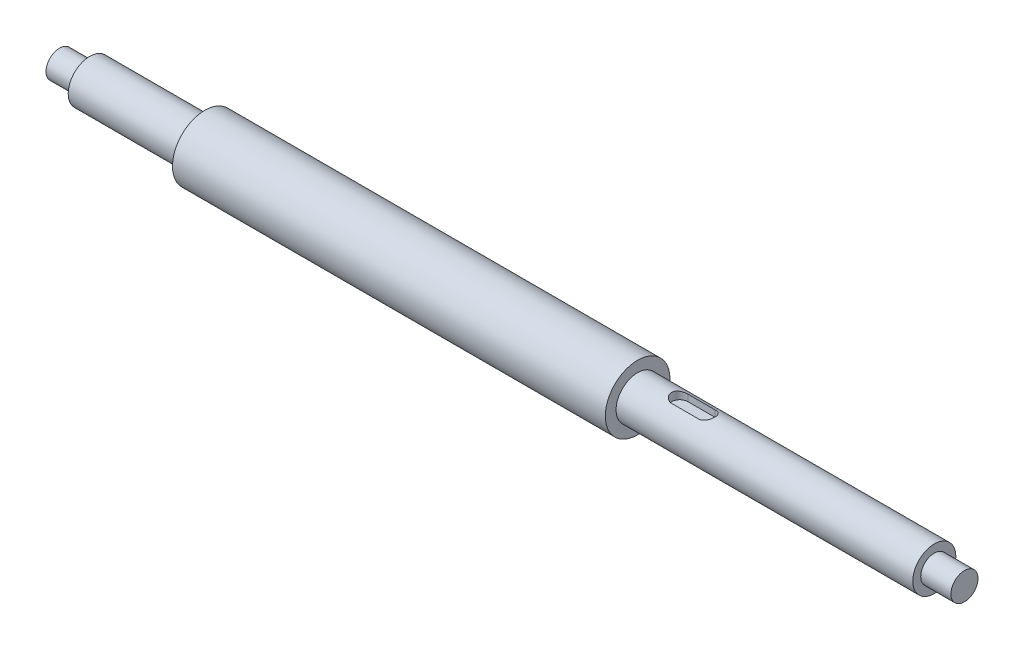
from build123d import *

# Parameters (mm, degrees)
SKETCH1_R           = 9.525
BOSS_EXTRUDE1_DEPTH = 266.7
SKETCH4_R           = 9.525
SKETCH4_R_2         = 6.35
CUT_EXTRUDE3_DEPTH  = 42.799
SKETCH5_R           = 6.35
SKETCH5_R_2         = 4
CUT_EXTRUDE4_DEPTH  = 8.89
CUT_EXTRUDE5_START  = -96.3295
SKETCH6_R           = 9.525
SKETCH6_R_2         = 6.35
CUT_EXTRUDE5_DEPTH  = 96.3295
CUT_EXTRUDE6_DEPTH  = 2.3876


with BuildPart() as part:
    # Sketch1 → Boss-Extrude1 (new body)
    with BuildSketch(Plane(origin=(0, 0, 0), x_dir=(0, 0, -1), z_dir=(1, 0, 0))):
        Circle(SKETCH1_R)
    extrude(amount=BOSS_EXTRUDE1_DEPTH)

    # Sketch4 → Cut-Extrude3 (cut)
    with BuildSketch(Plane.ZY):
        Circle(SKETCH4_R)
        Circle(SKETCH4_R_2, mode=Mode.SUBTRACT)
    extrude(amount=-CUT_EXTRUDE3_DEPTH, mode=Mode.SUBTRACT)

    # Sketch5 → Cut-Extrude4 (cut)
    with BuildSketch(Plane.ZY):
        Circle(SKETCH5_R)
        Circle(SKETCH5_R_2, mode=Mode.SUBTRACT)
    cut_extrude4 = extrude(amount=-CUT_EXTRUDE4_DEPTH, mode=Mode.SUBTRACT)

    # Sketch6 → Cut-Extrude5 (cut)
    with BuildSketch(Plane(origin=(266.7, 0, 0), x_dir=(0, 0, -1), z_dir=(1, 0, 0)).offset(CUT_EXTRUDE5_START)):
        Circle(SKETCH6_R)
        Circle(SKETCH6_R_2, mode=Mode.SUBTRACT)
    extrude(amount=CUT_EXTRUDE5_DEPTH, mode=Mode.SUBTRACT)

    # Mirror1: Cut-Extrude4 across plane
    add(cut_extrude4.mirror(Plane.ZY.offset(-133.35)), mode=Mode.SUBTRACT)

    # Sketch7 → Cut-Extrude6 (cut)
    with BuildSketch(Plane(origin=(0, 6.35, 0), x_dir=(1, 0, 0), z_dir=(0, 1, 0))):
        with BuildLine():
            Line((182.7911, 2.38125), (190.7286, 2.38125))
            ThreePointArc((190.7286, 2.38125), (193.10985, 0), (190.7286, -2.38125))
            Line((190.7286, -2.38125), (182.7911, -2.38125))
            ThreePointArc((182.7911, -2.38125), (180.40985, 0), (182.7911, 2.38125))
        make_face()
    extrude(amount=-CUT_EXTRUDE6_DEPTH, mode=Mode.SUBTRACT)


solid = part.part
